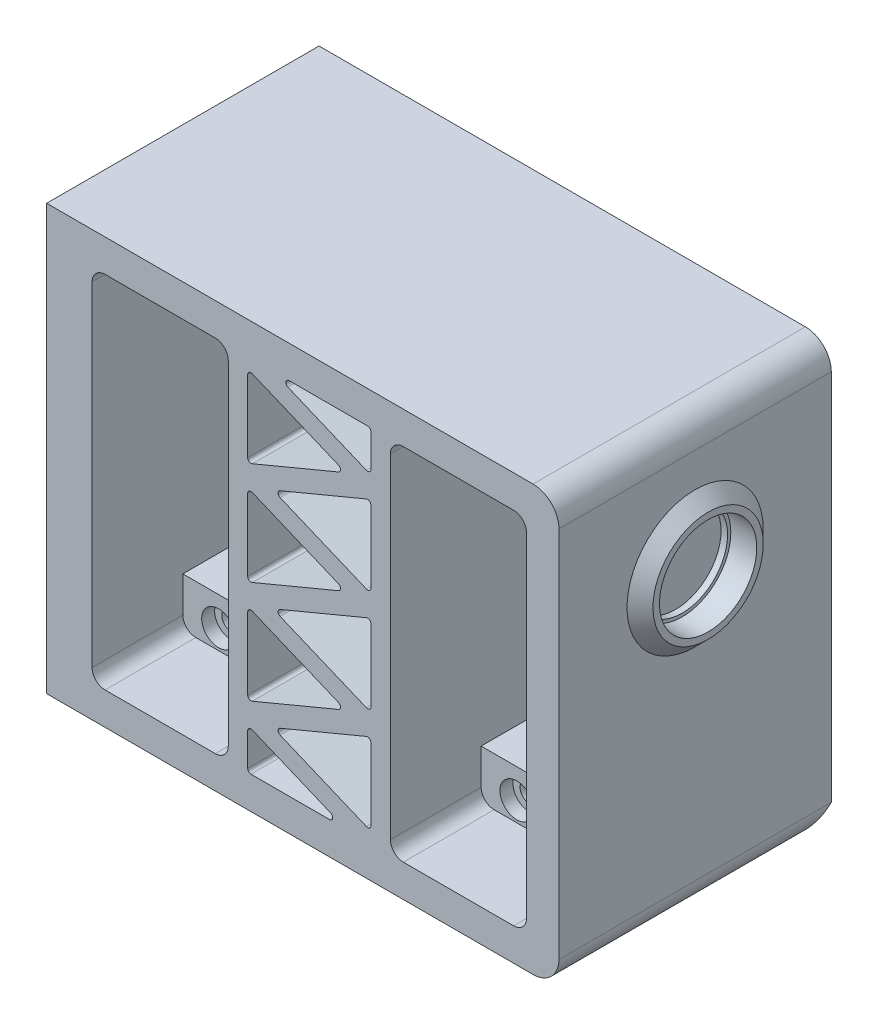
from build123d import *

# Parameters (mm, degrees)
SKETCH1_W           = 77
SKETCH1_H           = 65.5
SKETCH1_W_2         = 21
SKETCH1_H_2         = 40.5
BOSS_EXTRUDE2_DEPTH = 28
SKETCH1_4_W         = 77
SKETCH1_4_H         = 65.5
SKETCH1_4_W_2       = 21
SKETCH1_4_H_2       = 55.5
BOSS_EXTRUDE4_DEPTH = 14
SKETCH1_5_R         = 1.5
CUT_EXTRUDE1_DEPTH  = 12
CUT_EXTRUDE2_DEPTH  = 110.468031863
FILLET4_R           = 0.5
SKETCH8_W           = 21
SKETCH8_H           = 20
CUT_EXTRUDE8_DEPTH  = 10
SKETCH13_W          = 42
SKETCH13_H          = 65.5
BOSS_EXTRUDE7_DEPTH = 2
FILLET3_R           = 2
SKETCH14_R          = 1.25
CUT_EXTRUDE9_DEPTH  = 7
FILLET7_R           = 4
SKETCH15_R          = 8.5
BOSS_EXTRUDE8_DEPTH = 2
SKETCH16_R          = 7.5
CUT_EXTRUDE10_DEPTH = 4
CHAMFER1_SIZE       = 2
SKETCH17_R          = 7
CUT_EXTRUDE11_DEPTH = 1
SKETCH18_R          = 2.6
CUT_EXTRUDE12_DEPTH = 2
CUT_EXTRUDE13_DEPTH = 108.866816028
SKETCH21_W          = 6.5
SKETCH21_H          = 6
CUT_EXTRUDE14_DEPTH = 5
CHAMFER4_SIZE       = 2


with BuildPart() as part:
    # Sketch1 → Boss-Extrude2 (new body)
    with BuildSketch(Plane.XY):
        with Locations((38.5, 32.75)):
            Rectangle(SKETCH1_W, SKETCH1_H)
        with Locations((15.5, 32.75)):
            Rectangle(SKETCH1_W_2, SKETCH1_H_2, mode=Mode.SUBTRACT)
        with Locations((61.5, 32.75)):
            Rectangle(SKETCH1_W_2, SKETCH1_H_2, mode=Mode.SUBTRACT)
    extrude(amount=-BOSS_EXTRUDE2_DEPTH)

    # Sketch1<4> → Boss-Extrude4 (add)
    with BuildSketch(Plane.XY):
        with Locations((38.5, 32.75)):
            Rectangle(SKETCH1_4_W, SKETCH1_4_H)
        with Locations((61.5, 32.75)):
            Rectangle(SKETCH1_4_W_2, SKETCH1_4_H_2, mode=Mode.SUBTRACT)
        with Locations((15.5, 32.75)):
            Rectangle(SKETCH1_4_W_2, SKETCH1_4_H_2, mode=Mode.SUBTRACT)
    extrude(amount=BOSS_EXTRUDE4_DEPTH)

    # Sketch1<5> → Cut-Extrude1 (cut)
    with BuildSketch(Plane.XY):
        with Locations((10.5, 57.5)):
            Circle(SKETCH1_5_R)
        with Locations((10.5, 8)):
            Circle(SKETCH1_5_R)
        with Locations((20.5, 8)):
            Circle(SKETCH1_5_R)
        with Locations((56.5, 8)):
            Circle(SKETCH1_5_R)
        with Locations((66.5, 8)):
            Circle(SKETCH1_5_R)
        with Locations((56.5, 57.5)):
            Circle(SKETCH1_5_R)
        with Locations((20.5, 57.5)):
            Circle(SKETCH1_5_R)
        with Locations((66.5, 57.5)):
            Circle(SKETCH1_5_R)
    extrude(amount=-CUT_EXTRUDE1_DEPTH, mode=Mode.SUBTRACT)

    # Sketch5 → Cut-Extrude2 (cut, through all)
    with BuildSketch(Plane.XY.offset(14)):
        Polygon((44.10498905, 52.571428571), (29, 58.874638288), (29, 46.268218855), align=None)
        Polygon((48, 60.5), (32.89501095, 60.5), (48, 54.196790284), align=None)
        Polygon((48, 38.339647426), (48, 50.946066859), (32.89501095, 44.642857143), align=None)
        Polygon((44.10498905, 36.714285714), (29, 43.017495431), (29, 30.411075998), align=None)
        Polygon((48, 22.482504569), (48, 35.088924002), (32.89501095, 28.785714286), align=None)
        Polygon((44.10498905, 20.857142857), (29, 27.160352574), (29, 14.553933141), align=None)
        Polygon((48, 6.625361712), (48, 19.231781145), (32.89501095, 12.928571429), align=None)
        Polygon((44.10498905, 5), (29, 11.303209716), (29, 5), align=None)
    extrude(amount=-CUT_EXTRUDE2_DEPTH, mode=Mode.SUBTRACT)

    # Fillet4
    fillet4_edges = [part.edges().sort_by_distance(p)[0] for p in [
        (44.10498905, 36.714285714, -7),
        (29, 30.411075998, -7),
        (29, 43.017495431, -7),
        (32.89501095, 28.785714286, -7),
        (48, 35.088924002, -7),
        (48, 22.482504569, -7),
        (32.89501095, 44.642857143, -7),
        (48, 50.946066859, -7),
        (48, 38.339647426, -7),
        (32.89501095, 60.5, -7),
        (48, 60.5, -7),
        (48, 54.196790284, -7),
        (29, 11.303209716, -7),
        (44.10498905, 5, -7),
        (29, 5, -7),
        (44.10498905, 20.857142857, -7),
        (29, 14.553933141, -7),
        (29, 27.160352574, -7),
        (32.89501095, 12.928571429, -7),
        (48, 19.231781145, -7),
        (48, 6.625361712, -7),
        (44.10498905, 52.571428571, -7),
        (29, 46.268218855, -7),
        (29, 58.874638288, -7),
    ]]
    fillet(fillet4_edges, radius=FILLET4_R)

    # Sketch8 → Cut-Extrude8 (cut)
    with BuildSketch(Plane(origin=(0, 12.5, 0), x_dir=(1, 0, 0), z_dir=(0, 1, 0))):
        with Locations((15.5, 18)):
            Rectangle(SKETCH8_W, SKETCH8_H)
        with Locations((61.5, 18)):
            Rectangle(SKETCH8_W, SKETCH8_H)
    cut_extrude8 = extrude(amount=-CUT_EXTRUDE8_DEPTH, mode=Mode.SUBTRACT)

    # Mirror2: Cut-Extrude8 across plane
    add(cut_extrude8.mirror(Plane.ZX.offset(32.75)), mode=Mode.SUBTRACT)

    # Sketch13 → Boss-Extrude7 (add)
    with BuildSketch(Plane.ZY):
        with Locations((-7, 32.75)):
            Rectangle(SKETCH13_W, SKETCH13_H)
    extrude(amount=BOSS_EXTRUDE7_DEPTH)

    # Fillet3
    fillet3_edges = [part.edges().sort_by_distance(p)[0] for p in [
        (5, 2.5, -18),
        (26, 2.5, -18),
        (51, 2.5, -18),
        (72, 2.5, -18),
        (5, 63, -18),
        (26, 63, -18),
        (51, 63, -18),
        (72, 63, -18),
        (5, 60.5, 7),
        (26, 60.5, 7),
        (26, 5, 7),
        (51, 60.5, 7),
        (72, 60.5, 7),
        (72, 5, 7),
        (51, 5, 7),
        (5, 5, 7),
    ]]
    fillet(fillet3_edges, radius=FILLET3_R)

    # Sketch14 → Cut-Extrude9 (cut)
    with BuildSketch(Plane.ZY.offset(2)):
        with Locations((-24, 61.5)):
            Circle(SKETCH14_R)
        with Locations((10, 61.5)):
            Circle(SKETCH14_R)
        with Locations((10, 4)):
            Circle(SKETCH14_R)
        with Locations((-24, 4)):
            Circle(SKETCH14_R)
    extrude(amount=-CUT_EXTRUDE9_DEPTH, mode=Mode.SUBTRACT)

    # Fillet7
    fillet7_edges = [part.edges().sort_by_distance(p)[0] for p in [
        (77, 65.5, -7),
        (77, 0, -7),
    ]]
    fillet(fillet7_edges, radius=FILLET7_R)

    # Sketch15 → Boss-Extrude8 (add)
    with BuildSketch(Plane(origin=(77, 0, 0), x_dir=(0, 0, -1), z_dir=(1, 0, 0))):
        with Locations((7, 45.75)):
            Circle(SKETCH15_R)
    extrude(amount=BOSS_EXTRUDE8_DEPTH)

    # Sketch16 → Cut-Extrude10 (cut)
    with BuildSketch(Plane(origin=(79, 0, 0), x_dir=(0, 0, -1), z_dir=(1, 0, 0))):
        with Locations((7, 45.75)):
            Circle(SKETCH16_R)
    extrude(amount=-CUT_EXTRUDE10_DEPTH, mode=Mode.SUBTRACT)

    # Chamfer1
    chamfer1_edges = [part.edges().sort_by_distance(p)[0] for p in [
        (77, 45.75, 1.5),
    ]]
    chamfer(chamfer1_edges, length=CHAMFER1_SIZE - 0.0001)  # a hair under: the kernel refuses the full size

    # Sketch17 → Cut-Extrude11 (cut)
    with BuildSketch(Plane(origin=(75, 0, 0), x_dir=(0, 0, -1), z_dir=(1, 0, 0))):
        with Locations((7, 45.75)):
            Circle(SKETCH17_R)
    extrude(amount=-CUT_EXTRUDE11_DEPTH, mode=Mode.SUBTRACT)

    # Sketch18 → Cut-Extrude12 (cut)
    with BuildSketch(Plane.XY):
        with Locations((10.5, 57.5)):
            Circle(SKETCH18_R)
        with Locations((20.5, 57.5)):
            Circle(SKETCH18_R)
        with Locations((56.5, 57.5)):
            Circle(SKETCH18_R)
        with Locations((66.5, 57.5)):
            Circle(SKETCH18_R)
        with Locations((66.5, 8)):
            Circle(SKETCH18_R)
        with Locations((56.5, 8)):
            Circle(SKETCH18_R)
        with Locations((20.5, 8)):
            Circle(SKETCH18_R)
        with Locations((10.5, 8)):
            Circle(SKETCH18_R)
    extrude(amount=-CUT_EXTRUDE12_DEPTH, mode=Mode.SUBTRACT)

    # Sketch19 → Cut-Extrude13 (cut, through all)
    with BuildSketch(Plane.ZY.offset(2)):
        Polygon((-28, 4), (-24, 0), (-28, 0), align=None)
    extrude(amount=-CUT_EXTRUDE13_DEPTH, mode=Mode.SUBTRACT)

    # Sketch21 → Cut-Extrude14 (cut)
    with BuildSketch(Plane(origin=(0, 0, -8), x_dir=(-1, 0, 0), z_dir=(0, 0, -1))):
        with Locations((-61.5, 56)):
            Rectangle(SKETCH21_W, SKETCH21_H)
        with Locations((-61.5, 9.5)):
            Rectangle(SKETCH21_W, SKETCH21_H)
        with Locations((-15.5, 9.5)):
            Rectangle(SKETCH21_W, SKETCH21_H)
        with Locations((-15.5, 56)):
            Rectangle(SKETCH21_W, SKETCH21_H)
    extrude(amount=-CUT_EXTRUDE14_DEPTH, mode=Mode.SUBTRACT)

    # Chamfer4
    chamfer4_edges = [part.edges().sort_by_distance(p)[0] for p in [
        (72, 8.5, -8),
        (72, 57, -8),
        (61.5, 63, -8),
        (51, 57, -8),
        (51.585786438, 62.414213562, -8),
        (71.414213562, 62.414213562, -8),
        (61.5, 2.5, -8),
        (51, 8.5, -8),
        (51.585786438, 3.085786438, -8),
        (71.414213562, 3.085786438, -8),
        (26, 8.5, -8),
        (26, 57, -8),
        (15.5, 63, -8),
        (5, 57, -8),
        (5.585786438, 62.414213562, -8),
        (25.414213562, 62.414213562, -8),
        (15.5, 2.5, -8),
        (5, 8.5, -8),
        (5.585786438, 3.085786438, -8),
        (25.414213562, 3.085786438, -8),
    ]]
    chamfer(chamfer4_edges, length=CHAMFER4_SIZE)


solid = part.part
